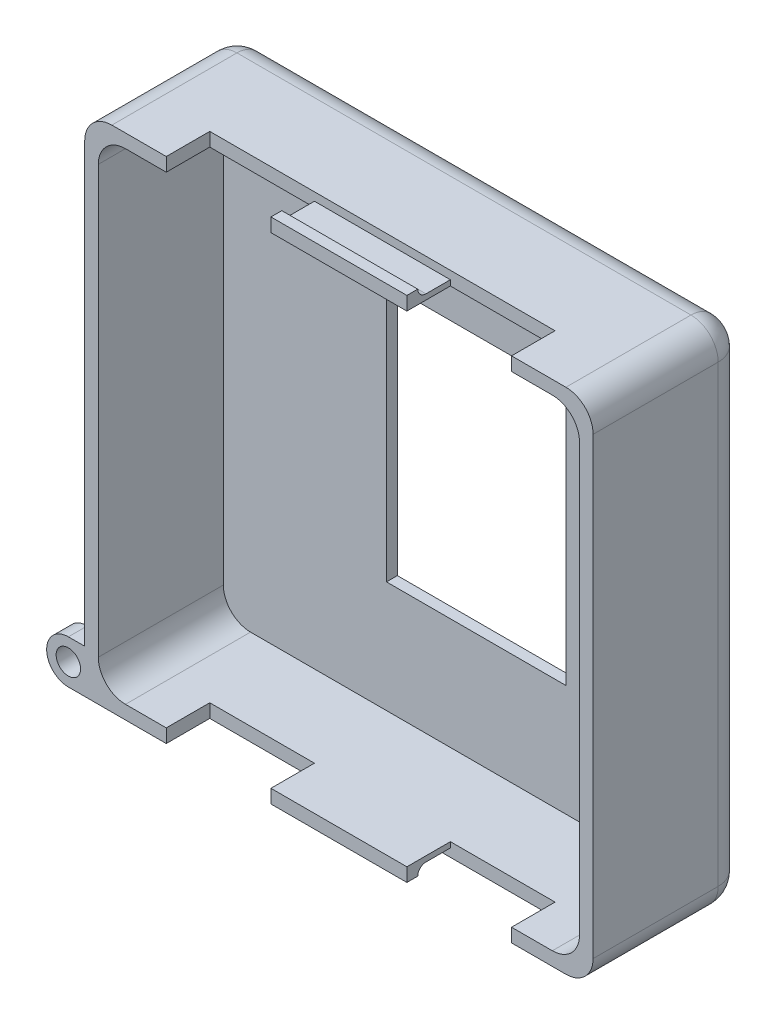
from build123d import *

# Parameters (mm, degrees)
BOSS_EXTRUDE1_DEPTH             = 14.224
CUT_EXTRUDE1_DEPTH              = 11.684
FILLET1_R                       = 2.54
CUT_EXTRUDE2_DEPTH              = 55.976332917
CUT_EXTRUDE2_DEPTH_BACK         = 55.976332917
SKETCH3_W                       = 32.258
SKETCH3_H                       = 8.128
SKETCH5_W                       = 26.924
SKETCH5_H                       = 34.29
CUT_EXTRUDE4_DEPTH              = 1.524
SKETCH6_W                       = 16.764
SKETCH6_H                       = 24.13
CUT_EXTRUDE5_DEPTH              = 1.524
SKETCH8_W                       = 12.7
SKETCH8_H                       = 0.508
BOSS_EXTRUDE3_DEPTH             = 4.064
SKETCH9_W                       = 12.7
SKETCH9_H                       = 1.016
BOSS_EXTRUDE4_DEPTH             = 0.762
FILLET2_R                       = 0.762
SKETCH10_W                      = 12.7
SKETCH10_H                      = 1.016
BOSS_EXTRUDE5_DEPTH             = 0.762
FILLET3_R                       = 0.762
SKETCH11_W                      = 1.778
SKETCH11_H                      = 4.064
BOSS_EXTRUDE6_DEPTH             = 3.556
BOSS_EXTRUDE6_DIRECTION_2_REACH = 56.976
FILLET4_RADIUS                  = 2.032
FILLET4_LENGTH                  = 1.778
SKETCH12_R                      = 1.143
CUT_EXTRUDE7_DEPTH              = 4.064
CUT_EXTRUDE8_DEPTH              = 0.762


with BuildPart() as part:
    # Sketch1 → Boss-Extrude1 (new body)
    with BuildSketch(Plane.XY):
        with BuildLine():
            Line((-21.209, -23.749), (21.209, -23.749))
            ThreePointArc((21.209, -23.749), (23.005051224, -23.005051224), (23.749, -21.209))
            Line((23.749, -21.209), (23.749, 21.209))
            ThreePointArc((23.749, 21.209), (23.005051224, 23.005051224), (21.209, 23.749))
            Line((21.209, 23.749), (-21.209, 23.749))
            ThreePointArc((-21.209, 23.749), (-23.005051224, 23.005051224), (-23.749, 21.209))
            Line((-23.749, 21.209), (-23.749, -21.209))
            ThreePointArc((-23.749, -21.209), (-23.005051224, -23.005051224), (-21.209, -23.749))
        make_face()
    extrude(amount=BOSS_EXTRUDE1_DEPTH)

    # Sketch2 → Cut-Extrude1 (cut)
    with BuildSketch(Plane.XY.offset(14.224)):
        with BuildLine():
            Line((19.939, -22.479), (-19.939, -22.479))
            ThreePointArc((-19.939, -22.479), (-21.735051224, -21.735051224), (-22.479, -19.939))
            Line((-22.479, -19.939), (-22.479, 19.939))
            ThreePointArc((-22.479, 19.939), (-21.735051224, 21.735051224), (-19.939, 22.479))
            Line((-19.939, 22.479), (19.939, 22.479))
            ThreePointArc((19.939, 22.479), (21.735051224, 21.735051224), (22.479, 19.939))
            Line((22.479, 19.939), (22.479, -19.939))
            ThreePointArc((22.479, -19.939), (21.735051224, -21.735051224), (19.939, -22.479))
        make_face()
    extrude(amount=-CUT_EXTRUDE1_DEPTH, mode=Mode.SUBTRACT)

    # Fillet1
    fillet1_edges = [part.edges().sort_by_distance(p)[0] for p in [
        (0, -23.749, 0),
        (-23.005051224, -23.005051224, 0),
        (-23.749, 0, 0),
        (-23.005051224, 23.005051224, 0),
        (0, 23.749, 0),
        (23.005051224, 23.005051224, 0),
        (23.749, 0, 0),
        (23.005051224, -23.005051224, 0),
    ]]
    fillet(fillet1_edges, radius=FILLET1_R)

    # Sketch3 → Cut-Extrude2 (cut, two sides: drawn at the far end of the back side and taken through both)
    with BuildSketch(Plane(origin=(0, 23.749, 0), x_dir=(1, 0, 0), z_dir=(0, 1, 0)).offset(-CUT_EXTRUDE2_DEPTH_BACK)):
        with Locations((0, -14.224)):
            Rectangle(SKETCH3_W, SKETCH3_H)
    extrude(amount=CUT_EXTRUDE2_DEPTH + CUT_EXTRUDE2_DEPTH_BACK, mode=Mode.SUBTRACT)

    # Sketch5 → Cut-Extrude4 (cut)
    with BuildSketch(Plane(origin=(0, 0, 0), x_dir=(-1, 0, 0), z_dir=(0, 0, -1))):
        with Locations((-1.143, 0)):
            Rectangle(SKETCH5_W, SKETCH5_H)
    extrude(amount=-CUT_EXTRUDE4_DEPTH, mode=Mode.SUBTRACT)

    # Sketch6 → Cut-Extrude5 (cut)
    with BuildSketch(Plane(origin=(0, 0, 1.524), x_dir=(-1, 0, 0), z_dir=(0, 0, -1))):
        with Locations((-1.143, 0)):
            Rectangle(SKETCH6_W, SKETCH6_H)
    extrude(amount=-CUT_EXTRUDE5_DEPTH, mode=Mode.SUBTRACT)

    # Sketch8 → Boss-Extrude3 (add)
    with BuildSketch(Plane.XY.offset(10.16)):
        with Locations((0, 22.733)):
            Rectangle(SKETCH8_W, SKETCH8_H)
        with Locations((0, -22.733)):
            Rectangle(SKETCH8_W, SKETCH8_H)
    extrude(amount=BOSS_EXTRUDE3_DEPTH)

    # Sketch9 → Boss-Extrude4 (add)
    with BuildSketch(Plane(origin=(0, 22.987, 0), x_dir=(1, 0, 0), z_dir=(0, 1, 0))):
        with Locations((0, -13.716)):
            Rectangle(SKETCH9_W, SKETCH9_H)
    extrude(amount=BOSS_EXTRUDE4_DEPTH)

    # Fillet2
    fillet2_edges = [part.edges().sort_by_distance(p)[0] for p in [
        (0, 22.987, 13.208),
    ]]
    fillet(fillet2_edges, radius=FILLET2_R - 0.0001)  # a hair under: the kernel refuses the full size

    # Sketch10 → Boss-Extrude5 (add)
    with BuildSketch(Plane.XZ.offset(22.987)):
        with Locations((0, 13.716)):
            Rectangle(SKETCH10_W, SKETCH10_H)
    extrude(amount=BOSS_EXTRUDE5_DEPTH)

    # Fillet3
    fillet3_edges = [part.edges().sort_by_distance(p)[0] for p in [
        (0, -22.987, 13.208),
    ]]
    fillet(fillet3_edges, radius=FILLET3_R - 0.0001)  # a hair under: the kernel refuses the full size

    # Sketch11 → Boss-Extrude6 (add)
    with BuildSketch(Plane.ZY.offset(23.749)):
        with Locations((13.335, -21.717)):
            Rectangle(SKETCH11_W, SKETCH11_H)
    extrude(amount=BOSS_EXTRUDE6_DEPTH)

    # Sketch11 → Boss-Extrude6 direction 2 (add, up to next)
    with BuildSketch(Plane.ZY.offset(23.749), mode=Mode.PRIVATE) as boss_extrude6_direction_2_sk1:
        with Locations((13.335, -21.717)):
            Rectangle(SKETCH11_W, SKETCH11_H)
    boss_extrude6_direction_2_tool1 = extrude(boss_extrude6_direction_2_sk1.sketch, amount=-BOSS_EXTRUDE6_DIRECTION_2_REACH, mode=Mode.PRIVATE) - part.part
    add(boss_extrude6_direction_2_tool1.solids().sort_by_distance((-23.749, -21.717, 13.335))[0])

    # Fillet4: full round fillet: the end face becomes a half cylinder, R = half its width
    fillet4_face = Plane((-27.305, -21.717, 13.335), x_dir=(0, 0, -1), z_dir=(-1, 0, 0))  # on the end face: x along it, z out of the body
    fillet4_slab = fillet4_face.offset(-FILLET4_RADIUS / 2) * Box(FILLET4_LENGTH, 2 * FILLET4_RADIUS, FILLET4_RADIUS, mode=Mode.PRIVATE)  # the body's end, R deep
    fillet4_round = Plane((-25.273, -21.717, 13.335), x_dir=(-1, 0, 0), z_dir=(0, 0, -1)) * Cylinder(FILLET4_RADIUS, FILLET4_LENGTH, mode=Mode.PRIVATE)  # its axis R under the face
    add(fillet4_slab - fillet4_round, mode=Mode.SUBTRACT)

    # Sketch12 → Cut-Extrude7 (cut)
    with BuildSketch(Plane(origin=(0, 0, 12.446), x_dir=(-1, 0, 0), z_dir=(0, 0, -1))):
        with Locations((25.273, -21.717)):
            Circle(SKETCH12_R)
    extrude(amount=-CUT_EXTRUDE7_DEPTH, mode=Mode.SUBTRACT)

    # Sketch7 → Cut-Extrude8 (cut)
    with BuildSketch(Plane(origin=(0, 0, 0), x_dir=(-1, 0, 0), z_dir=(0, 0, -1))):
        with BuildLine():
            Line((19.939, 17.145), (21.209, 17.145))
            ThreePointArc((21.209, 17.145), (17.399, 20.955), (13.589, 17.145))
            Line((13.589, 17.145), (14.859, 17.145))
            ThreePointArc((14.859, 17.145), (17.399, 19.685), (19.939, 17.145))
        make_face()
        with BuildLine():
            Line((21.209, 15.875), (16.129, 15.875))
            ThreePointArc((16.129, 15.875), (13.589, 13.335), (16.129, 10.795))
            Line((16.129, 10.795), (21.209, 10.795))
            Line((21.209, 10.795), (21.209, 12.065))
            Line((21.209, 12.065), (16.129, 12.065))
            ThreePointArc((16.129, 12.065), (14.859, 13.335), (16.129, 14.605))
            Line((16.129, 14.605), (21.209, 14.605))
            Line((21.209, 14.605), (21.209, 15.875))
        make_face()
        Polygon((13.589, 9.525), (21.209, 9.525), (21.209, 5.715), (19.939, 5.715), (19.939, 8.255), (18.034, 8.255), (18.034, 6.985), (16.764, 6.985), (16.764, 8.255), (13.589, 8.255), align=None)
        Polygon((13.589, 4.445), (21.209, 4.445), (21.209, 0.635), (19.939, 0.635), (19.939, 3.175), (18.034, 3.175), (18.034, 1.905), (16.764, 1.905), (16.764, 3.175), (13.589, 3.175), align=None)
        Polygon((21.209, -0.635), (13.589, -0.635), (13.589, -4.445), (14.859, -4.445), (14.859, -1.905), (21.209, -1.905), align=None)
        Polygon((13.589, -5.715), (21.209, -5.715), (21.209, -9.525), (19.939, -9.525), (19.939, -6.985), (18.034, -6.985), (18.034, -8.255), (16.764, -8.255), (16.764, -6.985), (14.859, -6.985), (14.859, -9.525), (13.589, -9.525), align=None)
        with BuildLine():
            Line((18.9865, -13.97), (18.9865, -15.24))
            ThreePointArc((18.9865, -15.24), (20.558044821, -11.445955179), (16.764, -13.0175))
            ThreePointArc((16.764, -13.0175), (15.137980791, -13.691019209), (15.8115, -12.065))
            Line((15.8115, -12.065), (15.8115, -10.795))
            ThreePointArc((15.8115, -10.795), (14.239955179, -14.589044821), (18.034, -13.0175))
            ThreePointArc((18.034, -13.0175), (19.660019209, -12.343980791), (18.9865, -13.97))
        make_face()
        with BuildLine():
            Line((15.8115, -17.78), (15.8115, -16.51))
            ThreePointArc((15.8115, -16.51), (14.239955179, -20.304044821), (18.034, -18.7325))
            ThreePointArc((18.034, -18.7325), (19.660019209, -18.058980791), (18.9865, -19.685))
            Line((18.9865, -19.685), (18.9865, -20.955))
            ThreePointArc((18.9865, -20.955), (20.558044821, -17.160955179), (16.764, -18.7325))
            ThreePointArc((16.764, -18.7325), (15.137980791, -19.406019209), (15.8115, -17.78))
        make_face()
    extrude(amount=-CUT_EXTRUDE8_DEPTH, mode=Mode.SUBTRACT)


solid = part.part
